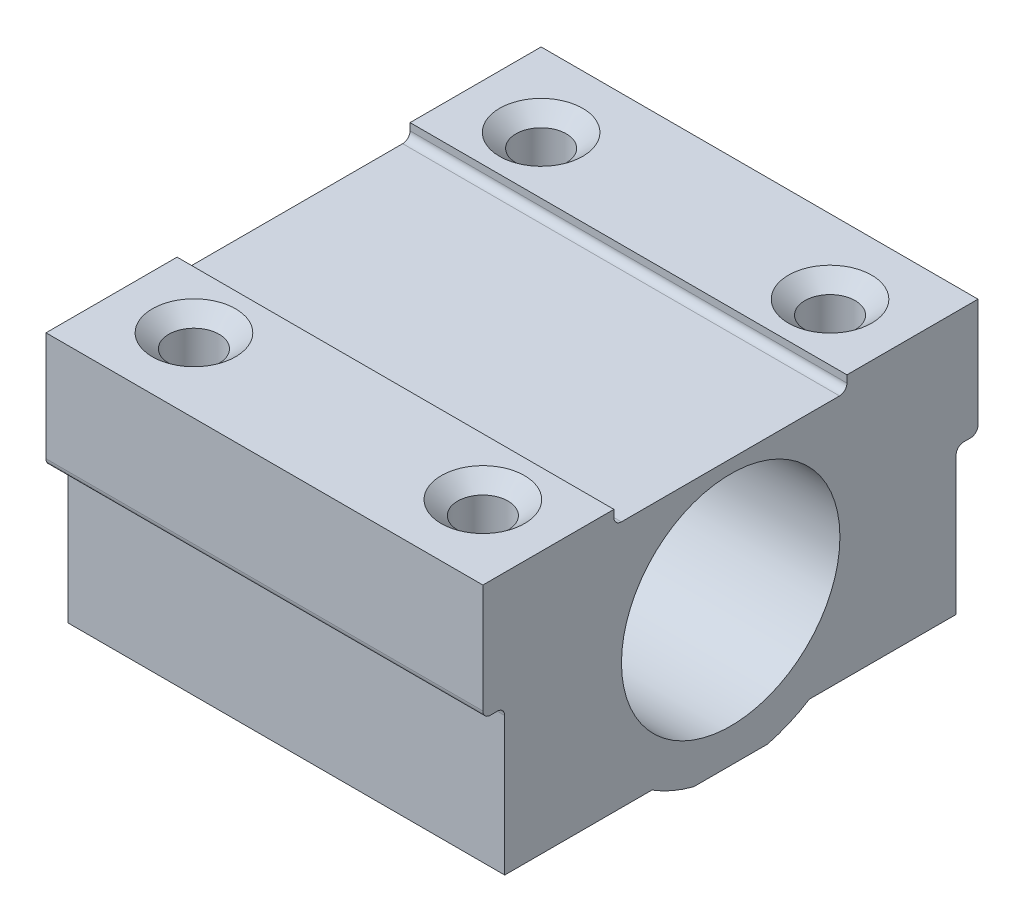
from build123d import *

# Parameters (mm, degrees)
SKETCH1_R                                         = 7.5
BOSS_EXTRUDE1_DEPTH                               = 30
CSK_FOR_4_FLAT_HEAD_MACHINE_SCREW_100_D           = 3.4544
CSK_FOR_4_FLAT_HEAD_MACHINE_SCREW_100_DEPTH       = 6.35
CSK_FOR_4_FLAT_HEAD_MACHINE_SCREW_100_CSINK_D     = 5.715
CSK_FOR_4_FLAT_HEAD_MACHINE_SCREW_100_CSINK_ANGLE = 100
CSK_FOR_4_FLAT_HEAD_MACHINE_SCREW_100_TIP         = 1.037806461
FILLET1_R                                         = 0.508


with BuildPart() as part:
    # Sketch1 → Boss-Extrude1 (new body)
    with BuildSketch(Plane(origin=(0, 0, 0), x_dir=(0, 0, -1), z_dir=(1, 0, 0))):
        with BuildLine():
            Line((32.5, 0), (34, 0))
            Line((34, 0), (34, 7.49375))
            Line((34, 7.49375), (34, 8))
            Line((34, 8), (25, 8))
            Line((25, 8), (25, 7))
            Line((25, 7), (9, 7))
            Line((9, 7), (9, 8))
            Line((9, 8), (0, 8))
            Line((0, 8), (0, 7.49375))
            Line((0, 7.49375), (0, 0))
            Line((0, 0), (1.5, 0))
            Line((1.5, 0), (1.5, -10))
            Line((1.5, -10), (11.611411797, -10))
            ThreePointArc((11.611411797, -10), (13.001010498, -10.730169916), (14.486500092, -11.237568497))
            Line((14.486500092, -11.237568497), (19.549499908, -11.237568497))
            ThreePointArc((19.549499908, -11.237568497), (21.034989502, -10.730169916), (22.424588203, -10))
            Line((22.424588203, -10), (32.5, -10))
            Line((32.5, -10), (32.5, 0))
        make_face()
        with Locations((17.018, -1.398)):
            Circle(SKETCH1_R, mode=Mode.SUBTRACT)
    extrude(amount=BOSS_EXTRUDE1_DEPTH)

    # CSK for #4 Flat Head Machine Screw (100)1
    with Locations(Plane(origin=(0, 8, 0), x_dir=(1, 0, 0), z_dir=(0, 1, 0))):
        with Locations((5.08, 28.92), (24.92, 28.92), (24.92, 5.08), (5.08, 5.08)):
            CounterSinkHole(CSK_FOR_4_FLAT_HEAD_MACHINE_SCREW_100_D / 2, CSK_FOR_4_FLAT_HEAD_MACHINE_SCREW_100_CSINK_D / 2, depth=CSK_FOR_4_FLAT_HEAD_MACHINE_SCREW_100_DEPTH, counter_sink_angle=CSK_FOR_4_FLAT_HEAD_MACHINE_SCREW_100_CSINK_ANGLE)
            with Locations((0, 0, -(CSK_FOR_4_FLAT_HEAD_MACHINE_SCREW_100_DEPTH + CSK_FOR_4_FLAT_HEAD_MACHINE_SCREW_100_TIP / 2))):  # 118° drill point
                Cone(0, CSK_FOR_4_FLAT_HEAD_MACHINE_SCREW_100_D / 2, CSK_FOR_4_FLAT_HEAD_MACHINE_SCREW_100_TIP, mode=Mode.SUBTRACT)

    # Fillet1
    fillet1_edges = [part.edges().sort_by_distance(p)[0] for p in [
        (15, 7, -25),
        (15, 7, -9),
        (15, 0, -34),
        (15, 0, -32.5),
        (15, 0, 0),
        (15, 0, -1.5),
    ]]
    fillet(fillet1_edges, radius=FILLET1_R)


solid = part.part
